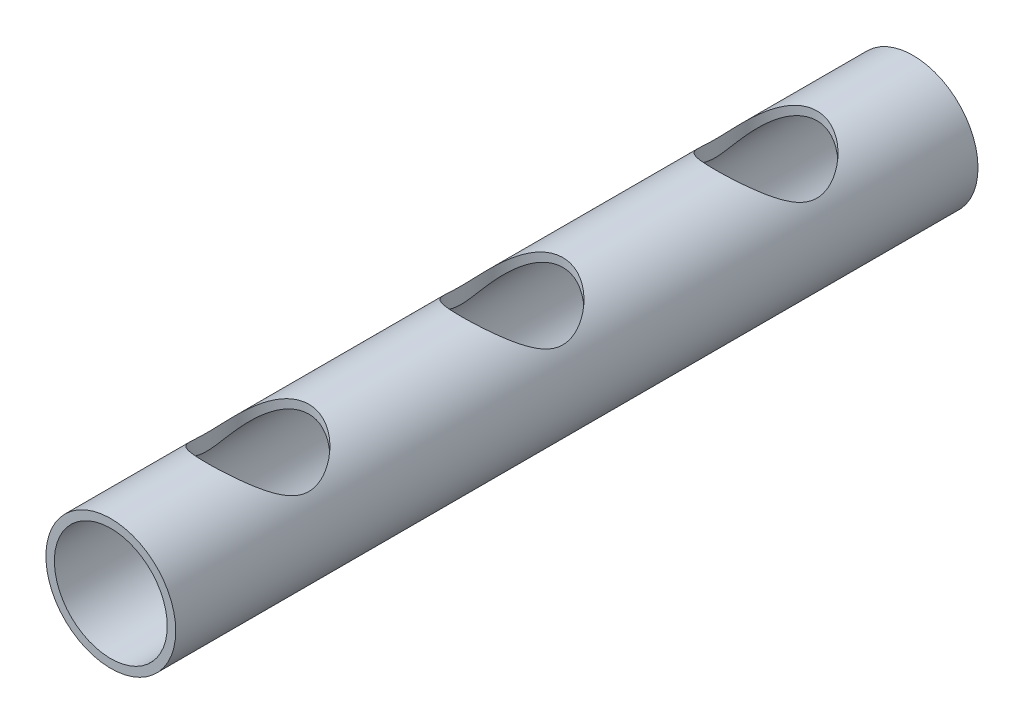
from build123d import *

# Parameters (mm, degrees)
SKETCH1_R           = 24.28
SKETCH1_R_2         = 21.105
BOSS_EXTRUDE1_DEPTH = 300
SKETCH2_R           = 19.05
CUT_EXTRUDE1_DEPTH  = 100


with BuildPart() as part:
    # Sketch1 → Boss-Extrude1 (new body)
    with BuildSketch(Plane.XY):
        Circle(SKETCH1_R)
        Circle(SKETCH1_R_2, mode=Mode.SUBTRACT)
    extrude(amount=BOSS_EXTRUDE1_DEPTH)

    # Sketch2 → Cut-Extrude1 (cut)
    with BuildSketch(Plane(origin=(0, 0, 0), x_dir=(1, 0, 0), z_dir=(0, 1, 0))):
        with Locations((0, -245)):
            Circle(SKETCH2_R)
        with Locations((0, -150)):
            Circle(SKETCH2_R)
        with Locations((0, -55)):
            Circle(SKETCH2_R)
    extrude(amount=CUT_EXTRUDE1_DEPTH, mode=Mode.SUBTRACT)


solid = part.part
